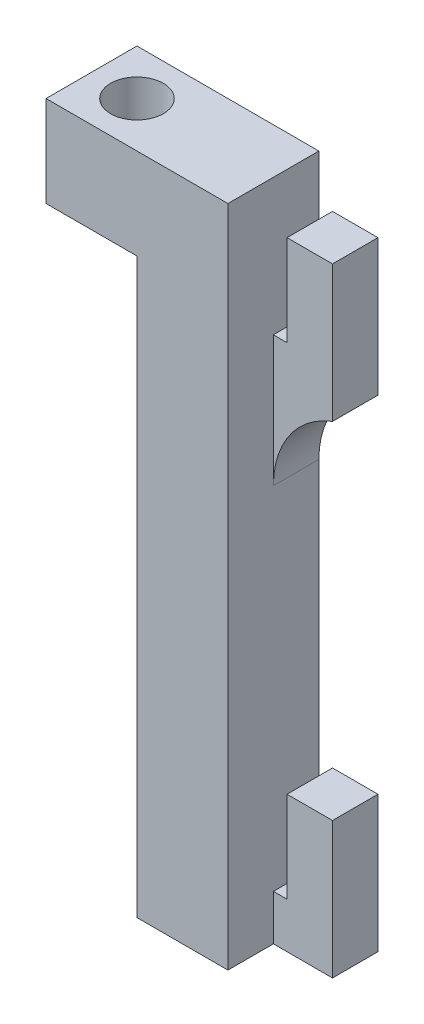
from build123d import *

# Parameters (mm, degrees)
BOSS_EXTRUDE1_DEPTH  = 5
SKETCH2_W            = 6.5
SKETCH2_H            = 5
CUT_EXTRUDE1_DEPTH   = 74.152238517
FILLET1_R            = 10
M5_CLEARANCE_HOLE1_D = 5.8


with BuildPart() as part:
    # Sketch1 → Boss-Extrude1 (new, symmetric)
    with BuildSketch(Plane.XY):
        Polygon((0, 0), (10, 0), (10, -63), (26.5, -63), (26.5, -48), (21.5, -48), (21.5, -58), (20, -58), (20, -10), (26.5, -10), (26.5, 5), (21.5, 5), (21.5, -5), (20, -5), (20, 10), (0, 10), align=None)
    extrude(amount=BOSS_EXTRUDE1_DEPTH, both=True)

    # Sketch2 → Cut-Extrude1 (cut, through all)
    with BuildSketch(Plane(origin=(0, 5, 0), x_dir=(1, 0, 0), z_dir=(0, 1, 0))):
        with Locations((23.25, -2.5)):
            Rectangle(SKETCH2_W, SKETCH2_H)
    extrude(amount=-CUT_EXTRUDE1_DEPTH, mode=Mode.SUBTRACT)

    # Fillet1
    # the kernel refuses this fillet: 10 mm, written as the material it adds along each edge
    with BuildSketch(Plane(origin=(20, -10, -5), x_dir=(0, -1, 0), z_dir=(0, 0, 1))) as fillet1_piece_1:
        with BuildLine():
            CenterArc((9.367496998, 10), FILLET1_R, 200.487315115, 69.512684885)
            Line((0, 6.5), (-0.18734994, 6.43))
            ThreePointArc((-0.18734994, 6.43), (-0.2, 3.25), (-0.2, 0))
            Line((-0.2, 0), (0, -0.2))
            Line((0, -0.2), (9.367496998, -0.2))
            Line((9.367496998, -0.2), (9.367496998, 0))
        make_face()
    extrude(amount=5)

    # M5 Clearance Hole1 (through all)
    with Locations(Plane(origin=(0, 10, 0), x_dir=(1, 0, 0), z_dir=(0, 1, 0))):
        with Locations((5, 0)):
            Hole(M5_CLEARANCE_HOLE1_D / 2)


solid = part.part
